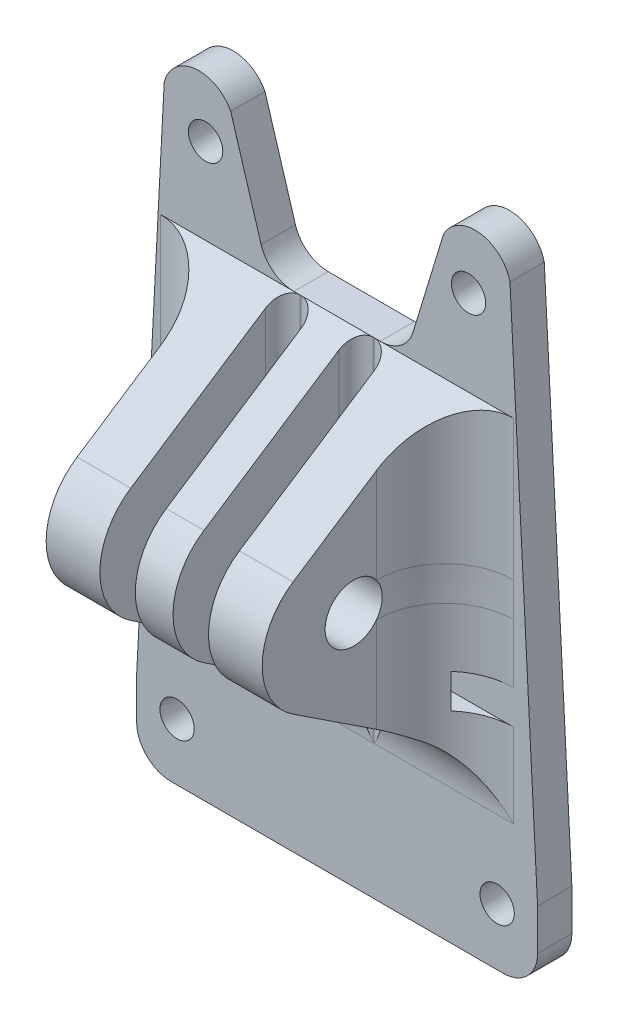
from build123d import *

# Parameters (mm, degrees)
CROQUIS1_R                   = 1.5000000000000042
CROQUIS1_R_2                 = 1.4999999999999991
CROQUIS1_R_3                 = 1.4999999999999931
CROQUIS1_R_4                 = 1.499999999999995
CROQUIS1_R_5                 = 1.5000000000000024
SALIENTE_EXTRUIR1_DEPTH      = 2
CROQUIS2_W                   = 21.071847777668022
CROQUIS2_H                   = 3.0000000000000107
CORTAR_EXTRUIR1_DEPTH        = 2
REDONDEO2_R                  = 1
REDONDEO1_R                  = 3
CROQUIS3_R                   = 1.4999999999999991
CROQUIS3_R_2                 = 1.4999999999999931
SALIENTE_EXTRUIR2_DEPTH      = 3
CORTAR_EXTRUIR2_START        = -2
CROQUIS4_W                   = 89.19699961388261
CROQUIS4_H                   = 188.9094693317581
CORTAR_EXTRUIR2_DEPTH        = 2
SALIENTE_EXTRUIR3_DEPTH      = 1.65
SALIENTE_EXTRUIR3_DEPTH_BACK = 1.65
CROQUIS5_R                   = 2.500000000000001
SALIENTE_EXTRUIR4_START      = 4.75
CROQUIS5_2_R                 = 2.500000000000001
SALIENTE_EXTRUIR4_DEPTH      = 4.7
SALIENTE_EXTRUIR5_START      = -9.45
CROQUIS5_3_R                 = 2.500000000000001
SALIENTE_EXTRUIR5_DEPTH      = 4.7
REDONDEO3_R                  = 1.5
REDONDEO4_R                  = 6
CORTAR_EXTRUIR3_DEPTH        = 10
CORTAR_EXTRUIR3_DEPTH_BACK   = 3.5
CORTAR_EXTRUIR4_START        = -21.4
CROQUIS9_W                   = 1.5000000000000009
CROQUIS9_H                   = 2.999999999999993
CORTAR_EXTRUIR4_DEPTH        = 30.9


with BuildPart() as part:
    # Croquis1 → Saliente-Extruir1 (new body)
    with BuildSketch(Plane.XY):
        Polygon((-17.535923888834034, 31.68825197279975), (-15, 79.99999999999999), (-3.74e-14, 83), (15, 79.99999999999999), (17.535923888834034, 31.688251972799723), (17.535923888834034, -31.68825197279971), (15.000000000000018, -79.99999999999999), (3.7e-16, -83), (-15.000000000000018, -79.99999999999999), (-17.535923888834006, -31.688251972799765), align=None)
        with Locations((-11.500000000000021, 75)):
            Circle(CROQUIS1_R, mode=Mode.SUBTRACT)
        with Locations((11.499999999999952, 75)):
            Circle(CROQUIS1_R_2, mode=Mode.SUBTRACT)
        with Locations((14, 29.999999999999975)):
            Circle(CROQUIS1_R_3, mode=Mode.SUBTRACT)
        with Locations((-14, 29.99999999999999)):
            Circle(CROQUIS1_R_4, mode=Mode.SUBTRACT)
        with Locations((-13.999999999999979, -29.999999999999996)):
            Circle(CROQUIS1_R_4, mode=Mode.SUBTRACT)
        with Locations((14.000000000000007, -29.999999999999968)):
            Circle(CROQUIS1_R_3, mode=Mode.SUBTRACT)
        with Locations((-11.499999999999993, -75)):
            Circle(CROQUIS1_R_5, mode=Mode.SUBTRACT)
        with Locations((11.499999999999993, -75)):
            Circle(CROQUIS1_R_5, mode=Mode.SUBTRACT)
    extrude(amount=SALIENTE_EXTRUIR1_DEPTH)

    # Croquis2 → Cortar-Extruir1 (cut)
    with BuildSketch(Plane.XY.offset(2)):
        Polygon((-10.0970966215454, 80.98058067569092), (-5.999999999999984, 67.49999999999999), (5.999999999999987, 67.49999999999999), (10.0970966215454, 80.98058067569092), (-3.74e-14, 83), align=None)
        Polygon((-10.000000000000014, 65), (-11.31046670601829, 40.034370085807616), (-1.9999999999999978, 52.0628646359715), align=None)
        Polygon((1.9999999999999996, 52.0628646359715), (10.000000000000018, 65), (11.31046670601829, 40.034370085807616), align=None)
        Polygon((0, 29.999999999999986), (-7.500000000000017, 37.49999999999999), (4.6e-16, 47.18949376811745), (7.500000000000019, 37.49999999999999), align=None)
        Polygon((-10.535923888834011, 17.99999999999999), (10.535923888834033, 17.99999999999999), (0, 4.500000000000004), align=None)
        Polygon((-12.500000000000005, 24.999999999999986), (12.500000000000007, 24.999999999999986), (12.500000000000009, 21.99999999999999), (-12.500000000000004, 21.99999999999999), align=None)
        Rectangle(CROQUIS2_W, CROQUIS2_H)
        Polygon((0, -4.500000000000004), (10.535923888834033, -17.99999999999999), (-10.535923888834011, -17.99999999999999), align=None)
        Polygon((12.500000000000028, -24.999999999999982), (12.50000000000003, -21.999999999999982), (-12.499999999999988, -21.999999999999996), (-12.499999999999988, -24.999999999999993), align=None)
        Polygon((7.500000000000046, -37.49999999999999), (3.515e-14, -47.18949376811745), (-7.499999999999986, -37.49999999999999), (2.082e-14, -29.999999999999986), align=None)
        Polygon((11.310466706018325, -40.0343700858076), (2.0000000000000413, -52.0628646359715), (10.000000000000066, -64.99999999999997), align=None)
        Polygon((-1.9999999999999563, -52.0628646359715), (-9.999999999999963, -65), (-11.310466706018259, -40.03437008580763), align=None)
        Polygon((10.0970966215454, -80.98058067569092), (2.505e-14, -83.00000000000003), (-10.097096621545361, -80.98058067569092), (-5.99999999999995, -67.49999999999999), (5.999999999999987, -67.49999999999999), align=None)
    extrude(amount=-CORTAR_EXTRUIR1_DEPTH, mode=Mode.SUBTRACT)

    # Redondeo2
    redondeo2_edges = [part.edges().sort_by_distance(p)[0] for p in [
        (-12.500000000000004, 21.99999999999999, 1),
        (-12.500000000000005, 24.999999999999986, 1),
        (12.500000000000007, 24.999999999999986, 1),
        (12.500000000000009, 21.99999999999999, 1),
        (11.31046670601829, 40.034370085807616, 1),
        (1.9999999999999996, 52.0628646359715, 1),
        (10.000000000000018, 65, 1),
        (-10.000000000000014, 65, 1),
        (-1.9999999999999978, 52.0628646359715, 1),
        (-11.31046670601829, 40.034370085807616, 1),
        (4.6e-16, 47.18949376811745, 1),
        (7.500000000000019, 37.49999999999999, 1),
        (0, 29.999999999999986, 1),
        (-7.500000000000017, 37.49999999999999, 1),
        (-10.535923888834011, -17.99999999999999, 1),
        (0, -4.500000000000004, 1),
        (10.535923888834033, -17.99999999999999, 1),
        (-10.535923888834011, 1.500000000000005, 1),
        (10.535923888834011, 1.500000000000005, 1),
        (10.535923888834011, -1.500000000000005, 1),
        (-10.535923888834011, -1.500000000000005, 1),
        (12.500000000000028, -24.999999999999982, 1),
        (-12.499999999999988, -24.999999999999993, 1),
        (-12.499999999999988, -21.999999999999996, 1),
        (12.50000000000003, -21.999999999999982, 1),
        (0, 4.500000000000004, 1),
        (-10.535923888834011, 17.99999999999999, 1),
        (10.535923888834033, 17.99999999999999, 1),
        (11.310466706018325, -40.0343700858076, 1),
        (10.000000000000066, -64.99999999999997, 1),
        (2.0000000000000413, -52.0628646359715, 1),
        (-7.499999999999986, -37.49999999999999, 1),
        (2.082e-14, -29.999999999999986, 1),
        (7.500000000000046, -37.49999999999999, 1),
        (3.515e-14, -47.18949376811745, 1),
        (-11.310466706018259, -40.03437008580763, 1),
        (-1.9999999999999563, -52.0628646359715, 1),
        (-9.999999999999963, -65, 1),
    ]]
    fillet(redondeo2_edges, radius=REDONDEO2_R)

    # Redondeo1
    # the kernel refuses this fillet: 3 mm, written as the material it adds along each edge
    with BuildSketch(Plane(origin=(-5.99999999999995, -67.49999999999999, 2), x_dir=(-0.29079205959554133, -0.956786276070149, 0), z_dir=(0, 0, -1))) as redondeo1_piece_1:
        with BuildLine():
            CenterArc((REDONDEO1_R * 0.741239666728, -REDONDEO1_R), REDONDEO1_R, 90, 73.09461857991337)
            Line((-REDONDEO1_R * 0.215546609342, -REDONDEO1_R * 0.709207940404), (0, 0))
            Line((0, 0), (REDONDEO1_R * 0.741239666728, 8e-17))
        make_face()
    extrude(amount=2)
    with BuildSketch(Plane(origin=(5.999999999999987, -67.49999999999999, 2), x_dir=(-1, 0, 0), z_dir=(0, 0, -1))) as redondeo1_piece_2:
        with BuildLine():
            CenterArc((REDONDEO1_R * 0.741239666728, -REDONDEO1_R), REDONDEO1_R, 90, 73.09461857991332)
            Line((-REDONDEO1_R * 0.215546609342, -REDONDEO1_R * 0.709207940404), (0, 0))
            Line((0, 0), (REDONDEO1_R * 0.741239666728, 0))
        make_face()
    extrude(amount=2)
    with BuildSketch(Plane(origin=(5.999999999999987, 67.49999999999999, 2), x_dir=(0.2907920595955413, 0.9567862760701489, 0), z_dir=(0, 0, -1))) as redondeo1_piece_3:
        with BuildLine():
            CenterArc((REDONDEO1_R * 0.741239666728, -REDONDEO1_R), REDONDEO1_R, 90, 73.09461857991329)
            Line((-REDONDEO1_R * 0.215546609342, -REDONDEO1_R * 0.709207940404), (0, 0))
            Line((0, 0), (REDONDEO1_R * 0.741239666728, 0))
        make_face()
    extrude(amount=2)
    with BuildSketch(Plane(origin=(-5.999999999999984, 67.49999999999999, 2), x_dir=(1, 0, 0), z_dir=(0, 0, -1))) as redondeo1_piece_4:
        with BuildLine():
            CenterArc((REDONDEO1_R * 0.741239666728, -REDONDEO1_R), REDONDEO1_R, 90, 73.09461857991332)
            Line((-REDONDEO1_R * 0.215546609342, -REDONDEO1_R * 0.709207940404), (0, 0))
            Line((0, 0), (REDONDEO1_R * 0.741239666728, 0))
        make_face()
    extrude(amount=2)
    # the kernel refuses this fillet: 3 mm, written as the material it takes off along each edge
    with BuildSketch(Plane(origin=(15.000000000000018, -79.99999999999999, -5.826545772830205), x_dir=(-0.9805806756909198, -0.1961161351381855, 0), z_dir=(0, 0, 1))) as redondeo1_2_piece_1:
        with BuildLine():
            CenterArc((REDONDEO1_R * 0.776872769711, -REDONDEO1_R), REDONDEO1_R, 89.99999999999993, 75.685321963672)
            Line((-REDONDEO1_R * 0.192079653677, -REDONDEO1_R * 0.752752752875), (0, 0))
            Line((0, 0), (REDONDEO1_R * 0.776872769711, 0))
        make_face()
    extrude(amount=13.65309154566041, mode=Mode.SUBTRACT)
    with BuildSketch(Plane(origin=(-15.000000000000018, -79.99999999999999, -5.82654577283022), x_dir=(-0.05241866824073038, 0.9986251965676953, 0), z_dir=(0, 0, 1))) as redondeo1_2_piece_2:
        with BuildLine():
            CenterArc((REDONDEO1_R * 0.776872769711, -REDONDEO1_R), REDONDEO1_R, 89.9999999999999, 75.68532196367254)
            Line((-REDONDEO1_R * 0.192079653677, -REDONDEO1_R * 0.752752752875), (0, 0))
            Line((0, 0), (REDONDEO1_R * 0.776872769711, 1e-17))
        make_face()
    extrude(amount=13.65309154566044, mode=Mode.SUBTRACT)
    with BuildSketch(Plane(origin=(15, 79.99999999999999, -5.826545772830196), x_dir=(0.052418668240731464, -0.9986251965676953, 0), z_dir=(0, 0, 1))) as redondeo1_2_piece_3:
        with BuildLine():
            CenterArc((REDONDEO1_R * 0.776872769711, -REDONDEO1_R), REDONDEO1_R, 90.0000000000001, 75.68532196367225)
            Line((-REDONDEO1_R * 0.192079653677, -REDONDEO1_R * 0.752752752875), (0, 0))
            Line((0, 0), (REDONDEO1_R * 0.776872769711, 1e-17))
        make_face()
    extrude(amount=13.653091545660391, mode=Mode.SUBTRACT)
    with BuildSketch(Plane(origin=(-15, 79.99999999999999, -5.826545772830201), x_dir=(0.9805806756909198, 0.19611613513818563, 0), z_dir=(0, 0, 1))) as redondeo1_2_piece_4:
        with BuildLine():
            CenterArc((REDONDEO1_R * 0.776872769711, -REDONDEO1_R), REDONDEO1_R, 89.99999999999997, 75.68532196367221)
            Line((-REDONDEO1_R * 0.192079653677, -REDONDEO1_R * 0.752752752875), (0, 0))
            Line((0, 0), (REDONDEO1_R * 0.776872769711, 0))
        make_face()
    extrude(amount=13.653091545660402, mode=Mode.SUBTRACT)
    with BuildSketch(Plane(origin=(10.0970966215454, -80.98058067569092, 8.80112750893172), x_dir=(-0.29079205959554183, 0.9567862760701488, 0), z_dir=(0, 0, -1))) as redondeo1_2_piece_5:
        with BuildLine():
            CenterArc((REDONDEO1_R * 0.906817001191, REDONDEO1_R), REDONDEO1_R, 185.59544894606648, 84.40455105393357)
            Line((-REDONDEO1_R * 0.0884181467465, REDONDEO1_R * 0.902496152332), (0, 0))
            Line((0, 0), (REDONDEO1_R * 0.906817001191, -9e-17))
        make_face()
    extrude(amount=15.602255017863438, mode=Mode.SUBTRACT)
    with BuildSketch(Plane(origin=(-10.097096621545361, -80.98058067569092, 8.80112750893171), x_dir=(-0.98058067569092, 0.1961161351381849, 0), z_dir=(0, 0, -1))) as redondeo1_2_piece_6:
        with BuildLine():
            CenterArc((REDONDEO1_R * 0.906817001191, REDONDEO1_R), REDONDEO1_R, 185.5954489460667, 84.40455105393323)
            Line((-REDONDEO1_R * 0.0884181467465, REDONDEO1_R * 0.902496152332), (0, 0))
            Line((0, 0), (REDONDEO1_R * 0.906817001191, 0))
        make_face()
    extrude(amount=15.60225501786342, mode=Mode.SUBTRACT)
    with BuildSketch(Plane(origin=(10.097096621545397, 80.9805806756909, 8.801127508931714), x_dir=(0.98058067569092, -0.1961161351381849, 0), z_dir=(0, 0, -1))) as redondeo1_2_piece_7:
        with BuildLine():
            CenterArc((REDONDEO1_R * 0.906817001191, REDONDEO1_R), REDONDEO1_R, 185.59544894606643, 84.40455105393352)
            Line((-REDONDEO1_R * 0.0884181467465, REDONDEO1_R * 0.902496152332), (0, 0))
            Line((0, 0), (REDONDEO1_R * 0.906817001191, 0))
        make_face()
    extrude(amount=15.602255017863428, mode=Mode.SUBTRACT)
    with BuildSketch(Plane(origin=(-10.0970966215454, 80.98058067569092, 8.801127508931721), x_dir=(0.29079205959554244, -0.9567862760701485, 0), z_dir=(0, 0, -1))) as redondeo1_2_piece_8:
        with BuildLine():
            CenterArc((REDONDEO1_R * 0.906817001191, REDONDEO1_R), REDONDEO1_R, 185.5954489460665, 84.40455105393357)
            Line((-REDONDEO1_R * 0.0884181467465, REDONDEO1_R * 0.902496152332), (0, 0))
            Line((0, 0), (REDONDEO1_R * 0.906817001191, 5e-17))
        make_face()
    extrude(amount=15.602255017863442, mode=Mode.SUBTRACT)
    with BuildSketch(Plane(origin=(17.535923888834034, -31.68825197279971, -0.19670522140385688), x_dir=(-0.052418668240729306, -0.9986251965676954, 0), z_dir=(0, 0, 1))) as redondeo1_2_piece_9:
        with BuildLine():
            CenterArc((REDONDEO1_R * 0.0262273628546, -REDONDEO1_R), REDONDEO1_R, 89.99999999999991, 3.004745562307292)
            Line((-REDONDEO1_R * 0.0261913053861, -REDONDEO1_R * 0.0013748034323), (0, 0))
            Line((0, 0), (REDONDEO1_R * 0.0262273628546, 0))
        make_face()
    extrude(amount=2.393410442819027, mode=Mode.SUBTRACT)
    with BuildSketch(Plane(origin=(17.535923888834034, 31.68825197279972, -0.196705221403858), x_dir=(0, -1, 0), z_dir=(0, 0, 1))) as redondeo1_2_piece_10:
        with BuildLine():
            CenterArc((REDONDEO1_R * 0.0262273628546, -REDONDEO1_R), REDONDEO1_R, 90, 3.004745562307292)
            Line((-REDONDEO1_R * 0.0261913053861, -REDONDEO1_R * 0.0013748034323), (0, 0))
            Line((0, 0), (REDONDEO1_R * 0.0262273628546, 0))
        make_face()
    extrude(amount=2.393410442819029, mode=Mode.SUBTRACT)
    with BuildSketch(Plane(origin=(-17.535923888834006, -31.68825197279977, -0.19670522140385693), x_dir=(0, 1, 0), z_dir=(0, 0, 1))) as redondeo1_2_piece_11:
        with BuildLine():
            CenterArc((REDONDEO1_R * 0.0262273628546, -REDONDEO1_R), REDONDEO1_R, 90, 3.0047455623073773)
            Line((-REDONDEO1_R * 0.0261913053861, -REDONDEO1_R * 0.0013748034323), (0, 0))
            Line((0, 0), (REDONDEO1_R * 0.0262273628546, 0))
        make_face()
    extrude(amount=2.393410442819027, mode=Mode.SUBTRACT)
    with BuildSketch(Plane(origin=(-17.535923888834034, 31.68825197279975, -0.19670522140385688), x_dir=(0, -1, 0), z_dir=(0, 0, 1))) as redondeo1_2_piece_12:
        with BuildLine():
            CenterArc((REDONDEO1_R * 0.0262273628546, REDONDEO1_R), REDONDEO1_R, 266.9952544376927, 3.004745562307278)
            Line((-REDONDEO1_R * 0.0261913053861, REDONDEO1_R * 0.0013748034323), (0, 0))
            Line((0, 0), (REDONDEO1_R * 0.0262273628546, 0))
        make_face()
    extrude(amount=2.393410442819027, mode=Mode.SUBTRACT)

    # Croquis3 → Saliente-Extruir2 (add)
    with BuildSketch(Plane.XY.offset(2)):
        with BuildLine():
            Line((-17.535923888834034, 31.609569884235903), (-15.122167907942169, 77.67258583291868))
            ThreePointArc((-15.122167907942169, 77.67258583291868), (-12.459435305483778, 80.04890829123904), (-9.306011071187744, 78.37769049075132))
            Line((-9.306011071187744, 78.37769049075132), (-6.646639828025497, 69.62762382121336))
            ThreePointArc((-6.646639828025497, 69.62762382121336), (-5.562739992297123, 68.08990368072561), (-3.7762809998150515, 67.49999999999999))
            Line((-3.7762809998150515, 67.49999999999999), (3.7762809998150595, 67.49999999999999))
            ThreePointArc((3.7762809998150595, 67.49999999999999), (5.562739992297126, 68.08990368072561), (6.646639828025497, 69.62762382121336))
            Line((6.646639828025497, 69.62762382121336), (9.30601107118774, 78.37769049075132))
            ThreePointArc((9.30601107118774, 78.37769049075132), (12.459435305483776, 80.04890829123904), (15.122167907942172, 77.67258583291868))
            Line((15.122167907942172, 77.67258583291868), (17.535923888834034, 31.609569884235903))
            Line((17.535923888834034, 31.609569884235903), (17.53592388883403, 28.000000000000007))
            ThreePointArc((17.53592388883403, 28.000000000000007), (16.657244232393673, 25.878679656440344), (14.53592388883401, 24.999999999999986))
            Line((14.53592388883401, 24.999999999999986), (-14.53592388883401, 24.999999999999986))
            ThreePointArc((-14.53592388883401, 24.999999999999986), (-16.657244232393673, 25.878679656440344), (-17.53592388883403, 28.000000000000007))
            Line((-17.53592388883403, 28.000000000000007), (-17.535923888834034, 31.609569884235903))
        make_face()
        with Locations((-11.500000000000021, 75)):
            Circle(CROQUIS3_R, mode=Mode.SUBTRACT)
        with Locations((-14, 29.99999999999999)):
            Circle(CROQUIS3_R_2, mode=Mode.SUBTRACT)
        with Locations(Location((14.000000000000004, 29.99999999999999, 0), (0, 0, 180))):
            Circle(CROQUIS3_R_2, mode=Mode.SUBTRACT)
        with Locations(Location((11.500000000000025, 75, 0), (0, 0, 180))):
            Circle(CROQUIS3_R, mode=Mode.SUBTRACT)
    extrude(amount=SALIENTE_EXTRUIR2_DEPTH)

    # Croquis4 → Cortar-Extruir2 (cut)
    with BuildSketch(Plane.XY.offset(2).offset(CORTAR_EXTRUIR2_START)):
        with Locations((3.252327620987927, 0.8693967542381458)):
            Rectangle(CROQUIS4_W, CROQUIS4_H)
    extrude(amount=CORTAR_EXTRUIR2_DEPTH, mode=Mode.SUBTRACT)

    # Croquis5 → Saliente-Extruir3 (add, two sides: drawn at the far end of the back side and taken through both)
    with BuildSketch(Plane(origin=(0, 0, 0), x_dir=(0, 0, -1), z_dir=(1, -1.2e-16, 0)).offset(-SALIENTE_EXTRUIR3_DEPTH_BACK)):
        with BuildLine():
            Line((-5, 67.49999999999999), (-18.295356866222487, 58.761951863092285))
            ThreePointArc((-18.295356866222487, 58.761951863092285), (-21.000000000000007, 53.747909270110014), (-18.295356866222484, 48.73386667712774))
            Line((-18.295356866222484, 48.73386667712774), (-5, 39.99581854022005))
            Line((-5, 39.99581854022005), (-5, 67.49999999999999))
        make_face()
        with Locations(Location((-13, 53.74790927011002, 0), (0, 0, 90))):
            Circle(CROQUIS5_R, mode=Mode.SUBTRACT)
    extrude(amount=SALIENTE_EXTRUIR3_DEPTH + SALIENTE_EXTRUIR3_DEPTH_BACK)

    # Croquis5<2> → Saliente-Extruir4 (add)
    with BuildSketch(Plane(origin=(0, 0, 0), x_dir=(0, 0, -1), z_dir=(1, -1.2e-16, 0)).offset(SALIENTE_EXTRUIR4_START)):
        with BuildLine():
            Line((-5, 67.49999999999999), (-18.295356866222487, 58.761951863092285))
            ThreePointArc((-18.295356866222487, 58.761951863092285), (-21.000000000000007, 53.747909270110014), (-18.295356866222484, 48.73386667712774))
            Line((-18.295356866222484, 48.73386667712774), (-5, 39.99581854022005))
            Line((-5, 39.99581854022005), (-5, 67.49999999999999))
        make_face()
        with Locations(Location((-13, 53.74790927011002, 0), (0, 0, 90))):
            Circle(CROQUIS5_2_R, mode=Mode.SUBTRACT)
    extrude(amount=SALIENTE_EXTRUIR4_DEPTH)

    # Croquis5<3> → Saliente-Extruir5 (add)
    with BuildSketch(Plane(origin=(0, 0, 0), x_dir=(0, 0, -1), z_dir=(1, -1.2e-16, 0)).offset(SALIENTE_EXTRUIR5_START)):
        with BuildLine():
            Line((-5, 67.49999999999999), (-18.295356866222487, 58.761951863092285))
            ThreePointArc((-18.295356866222487, 58.761951863092285), (-21.000000000000007, 53.747909270110014), (-18.295356866222484, 48.73386667712774))
            Line((-18.295356866222484, 48.73386667712774), (-5, 39.99581854022005))
            Line((-5, 39.99581854022005), (-5, 67.49999999999999))
        make_face()
        with Locations(Location((-13, 53.74790927011002, 0), (0, 0, 90))):
            Circle(CROQUIS5_3_R, mode=Mode.SUBTRACT)
    extrude(amount=SALIENTE_EXTRUIR5_DEPTH)

    # Redondeo3
    # the kernel refuses this fillet: 1.5 mm, written as the material it adds along each edge
    with BuildSketch(Plane(origin=(-1.6499999999999955, 36.24581854022005, 5), x_dir=(-1, 1.2e-16, 0), z_dir=(1.2e-16, 1, 0))) as redondeo3_piece_1_section:
        with BuildLine():
            CenterArc((REDONDEO3_R, REDONDEO3_R), REDONDEO3_R, 180, 90)
            Line((-4.4e-16, REDONDEO3_R), (0, 0))
            Line((0, 0), (REDONDEO3_R, 0))
        make_face()
    redondeo3_piece_1 = extrude(amount=31.254181459779936, mode=Mode.PRIVATE)
    redondeo3_piece_1 = split(redondeo3_piece_1, bisect_by=Plane(origin=(-1.9925823503575335, 44.29754419422067, 11.54528068676474), z_dir=(0, 0.8356737654970444, -0.5492261443704141)), keep=Keep.TOP, mode=Mode.PRIVATE)
    redondeo3_piece_1 = split(redondeo3_piece_1, bisect_by=Plane(origin=(-1.9925823503575313, 63.19803239842101, 11.545648821541143), z_dir=(0, -0.8356737654970443, -0.5492261443704143)), keep=Keep.TOP, mode=Mode.PRIVATE)
    add(redondeo3_piece_1)
    with BuildSketch(Plane(origin=(1.6500000000000044, 36.24581854022005, 5), x_dir=(1, -1.2e-16, 0), z_dir=(1.2e-16, 1, 0))) as redondeo3_piece_2_section:
        with BuildLine():
            CenterArc((REDONDEO3_R, -REDONDEO3_R), REDONDEO3_R, 90, 90)
            Line((-4.4e-16, -REDONDEO3_R), (0, 0))
            Line((0, 0), (REDONDEO3_R, 0))
        make_face()
    redondeo3_piece_2 = extrude(amount=31.254181459779936, mode=Mode.PRIVATE)
    redondeo3_piece_2 = split(redondeo3_piece_2, bisect_by=Plane(origin=(1.9925823503575493, 44.297544194220706, 11.545280686764793), z_dir=(0, 0.8356737654970444, -0.5492261443704141)), keep=Keep.TOP, mode=Mode.PRIVATE)
    redondeo3_piece_2 = split(redondeo3_piece_2, bisect_by=Plane(origin=(1.9925823503575515, 63.19803239842105, 11.545648821541086), z_dir=(0, -0.8356737654970443, -0.5492261443704143)), keep=Keep.TOP, mode=Mode.PRIVATE)
    add(redondeo3_piece_2)
    with BuildSketch(Plane(origin=(4.750000000000004, 36.24581854022005, 5), x_dir=(-1, 1.2e-16, 0), z_dir=(1.2e-16, 1, 0))) as redondeo3_piece_3_section:
        with BuildLine():
            CenterArc((REDONDEO3_R, REDONDEO3_R), REDONDEO3_R, 180, 90)
            Line((0, REDONDEO3_R), (0, 0))
            Line((0, 0), (REDONDEO3_R, 0))
        make_face()
    redondeo3_piece_3 = extrude(amount=35.004181459779936, mode=Mode.PRIVATE)
    redondeo3_piece_3 = redondeo3_piece_3 - Plane(origin=(3.7762809998162434, 70.50000000000018, 5.33452294186996), x_dir=(0.2907920595960027, 0.9567862760700087, 0), z_dir=(0, 0, 1)) * Cylinder(3, 77, mode=Mode.PRIVATE)
    redondeo3_piece_3 = split(redondeo3_piece_3, bisect_by=Plane(origin=(4.4074176496458595, 63.19803239842781, 11.545648821530797), z_dir=(0, -0.8356737654970443, -0.5492261443704143)), keep=Keep.TOP, mode=Mode.PRIVATE)
    redondeo3_piece_3 = split(redondeo3_piece_3, bisect_by=Plane(origin=(4.407417649645858, 44.29754419422985, 11.54528068677871), z_dir=(0, 0.8356737654970444, -0.5492261443704141)), keep=Keep.TOP, mode=Mode.PRIVATE)
    add(redondeo3_piece_3)
    with BuildSketch(Plane(origin=(-4.749999999999995, 36.24581854022005, 5), x_dir=(1, -1.2e-16, 0), z_dir=(1.2e-16, 1, 0))) as redondeo3_piece_4_section:
        with BuildLine():
            CenterArc((REDONDEO3_R, -REDONDEO3_R), REDONDEO3_R, 90, 90)
            Line((0, -REDONDEO3_R), (0, 0))
            Line((0, 0), (REDONDEO3_R, 0))
        make_face()
    redondeo3_piece_4 = extrude(amount=35.004181459779936, mode=Mode.PRIVATE)
    redondeo3_piece_4 = redondeo3_piece_4 - Plane(origin=(-3.776280999816, 70.5, 5.334522941869959), x_dir=(1, 0, 0), z_dir=(0, 0, 1)) * Cylinder(3, 77, mode=Mode.PRIVATE)
    redondeo3_piece_4 = split(redondeo3_piece_4, bisect_by=Plane(origin=(-4.407417649645826, 63.19803239842789, 11.545648821530673), z_dir=(0, -0.8356737654970443, -0.5492261443704143)), keep=Keep.TOP, mode=Mode.PRIVATE)
    redondeo3_piece_4 = split(redondeo3_piece_4, bisect_by=Plane(origin=(-4.407417649645829, 44.29754419422993, 11.54528068677883), z_dir=(0, 0.8356737654970444, -0.5492261443704141)), keep=Keep.TOP, mode=Mode.PRIVATE)
    add(redondeo3_piece_4)

    # Redondeo4
    redondeo4_edges = [part.edges().sort_by_distance(p)[0] for p in [
        (6.350000000000002, 39.995818540221535, 5),
        (0, 39.99581854022322, 5),
        (-6.349999999999997, 39.995818540221535, 5),
        (9.450000000000006, 53.747909270110014, 5),
        (-9.449999999999992, 53.747909270110014, 5),
    ]]
    fillet(redondeo4_edges, radius=REDONDEO4_R)

    # Croquis7 → Cortar-Extruir3 (cut, two sides: drawn at the far end of the back side and taken through both)
    with BuildSketch(Plane.ZY.offset(9.45).offset(-CORTAR_EXTRUIR3_DEPTH_BACK)):
        Polygon((14.835325870964482, 49.509405727501886), (17.588314677411226, 53.218096327283995), (15.752988806446742, 57.45659986989213), (11.164674129035518, 57.986412812718164), (8.411685322588774, 54.27772221293604), (10.247011193553265, 50.0392186703279), align=None)
    extrude(amount=CORTAR_EXTRUIR3_DEPTH + CORTAR_EXTRUIR3_DEPTH_BACK, mode=Mode.SUBTRACT)

    # Croquis9 → Cortar-Extruir4 (cut)
    with BuildSketch(Plane.ZY.offset(5.949999999999993).offset(CORTAR_EXTRUIR4_START)):
        with Locations((5.75, 45.599554256262735)):
            Rectangle(CROQUIS9_W, CROQUIS9_H)
    extrude(amount=CORTAR_EXTRUIR4_DEPTH, mode=Mode.SUBTRACT)


solid = part.part
